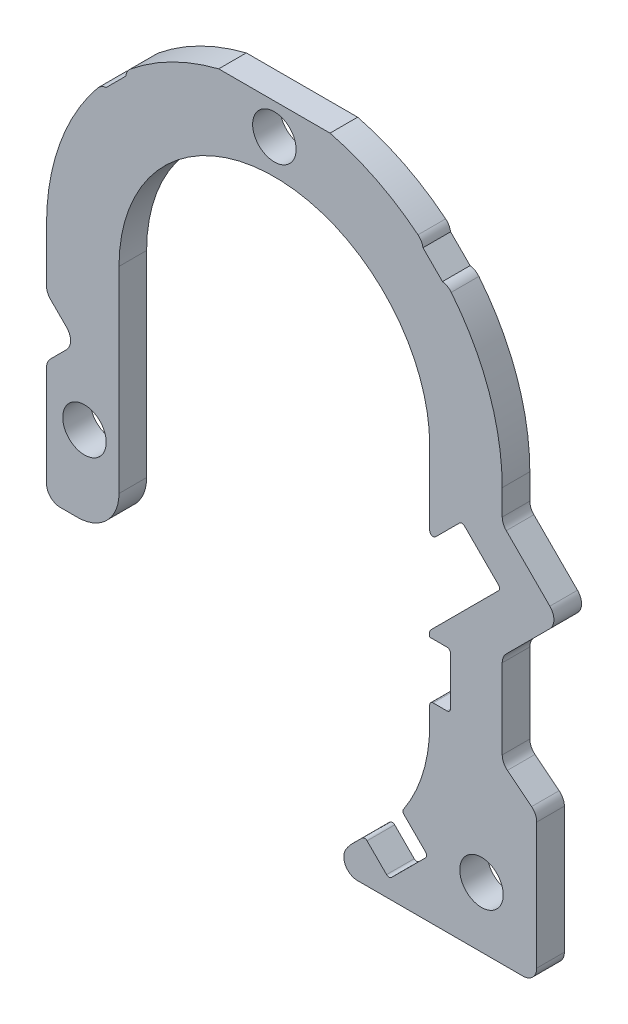
from build123d import *

# Parameters (mm, degrees)
CORPS_DEPTH                     = 4
DIAM_TRE_DU_PER_AGE_6_2_6_3_1_D = 6.3
RENFORT_CAVITE_IR_DEPTH         = 4
CAVITE_IR_DEPTH                 = 73.7636828920554
CAVITE_SWITCH_DEPTH             = 73.7636828920554
CONG_1_R                        = 2
CONG_2_R                        = 0.5


with BuildPart() as part:
    # Esquisse1 → corps (new body)
    with BuildSketch(Plane.XY):
        with BuildLine():
            Line((-21.522272155725624, 24.35069928047194), (-21.522272155725624, 25.01583101267831))
            ThreePointArc((-21.522272155725624, 25.01583101267831), (-15.198873528041206, 29.291538769388826), (-8.062257748298553, 32))
            Line((-8.062257748298553, 32), (8.062257748298553, 32))
            ThreePointArc((8.062257748298553, 32), (15.198873528041206, 29.29153876938882), (21.522272155725624, 25.015831012678305))
            Line((21.522272155725624, 25.015831012678305), (21.522272155725624, 24.350699280471943))
            Line((21.522272155725624, 24.350699280471943), (24.35069928047182, 21.522272155725762))
            Line((24.35069928047182, 21.522272155725762), (25.015831012678188, 21.522272155725762))
            ThreePointArc((25.015831012678188, 21.522272155725762), (30.93963819615851, 11.477751883135042), (33, 0))
            Line((33, 0), (33, -34.48090133377067))
            Line((33, -34.48090133377067), (38, -38.48090133377066))
            Line((38, -38.48090133377066), (38, -59.76396103067893))
            Line((38, -59.76396103067893), (9.515567427896173, -59.76396103067893))
            ThreePointArc((9.515567427896173, -59.76396103067893), (9.973004843675767, -57.46613597206372), (11.275567427896174, -55.51868129902402))
            Line((11.275567427896174, -55.51868129902402), (15.9, -50.9))
            ThreePointArc((15.9, -50.9), (20.78460969082653, -43.597044976101124), (22.500000000000004, -34.98020100629408))
            Line((22.500000000000004, -34.98020100629408), (22.5, 0))
            ThreePointArc((22.5, 0), (1.38e-15, 22.5), (-22.5, 0))
            Line((-22.5, 0), (-22.5, -28.480901333770667))
            ThreePointArc((-22.5, -28.480901333770667), (-24.257359312880713, -32.723542020889944), (-28.499999999999993, -34.48090133377067))
            Line((-28.499999999999993, -34.48090133377067), (-33, -34.48090133377067))
            Line((-33, -34.48090133377067), (-33, 0))
            ThreePointArc((-33, 0), (-30.939638196158512, 11.477751883135037), (-25.015831012678195, 21.522272155725755))
            Line((-25.015831012678195, 21.522272155725755), (-24.35069928047182, 21.52227215572576))
            Line((-24.35069928047182, 21.52227215572576), (-21.522272155725624, 24.35069928047194))
        make_face()
    extrude(amount=CORPS_DEPTH)

    # Diamètre du perçage Ø6.2 (6.3)1 (through all)
    with Locations(Plane.XY.offset(4)):
        with Locations((0, 27.5), (30, -51), (-27.5, -23)):
            Hole(DIAM_TRE_DU_PER_AGE_6_2_6_3_1_D / 2)

    # Esquisse4 → renfort_cavite_IR (add, through all)
    with BuildSketch(Plane.XY):
        Polygon((31.414213562373053, -2.928932188134515), (41.313708498984774, -12.828427124746126), (34.525483399593966, -19.61665222413702), (27.454415587728445, -26.68772003600261), (24.62598846298224, -9.717157287525408), align=None)
    extrude(amount=RENFORT_CAVITE_IR_DEPTH)

    # Esquisse4<4> → cavite_IR (cut, through all)
    with BuildSketch(Plane.XY):
        Polygon((4.3e-16, -34.34314575050794), (24.62598846298224, -9.717157287525408), (27.17157287525379, -7.171572875253825), (32.828427124746206, -12.828427124746176), (30.282842712474658, -15.37401153701776), (1.73e-15, -45.65685424949275), align=None)
        Polygon((-75.93969696196702, -31.797561338236385), (-42.82842712474626, 1.313708498984752), (-28.686291501015212, -12.828427124746126), (-61.79756133823598, -45.93969696196728), align=None)
    extrude(amount=CAVITE_IR_DEPTH, mode=Mode.SUBTRACT)

    # Esquisse5 → cavite_switch (cut, through all)
    with BuildSketch(Plane.XY):
        Polygon((18.90520382004283, -48.24834957055045), (21.910407640085666, -51.25355339059327), (22.263961030678935, -51.607106781186545), (16.607106781186562, -57.26396103067893), (16.253553390593282, -56.910407640085644), (13.24834957055045, -53.905203820042814), (12.894796179957178, -53.551650429449545), (11.671501448504449, -52.32835569799682), (17.32835569799682, -46.671501448504436), (18.55165042944955, -47.89479617995717), align=None)
        Polygon((20.249999999999996, -31.999999999999993), (18.51999999999999, -32), (18.51999999999999, -23.999999999999993), (20.249999999999996, -23.999999999999996), (20.750000000000007, -23.99999999999999), (25.000000000000007, -23.99999999999999), (25.50000000000001, -24), (25.500000000000007, -32), (25.00000000000001, -32), (20.750000000000007, -32), align=None)
    extrude(amount=CAVITE_SWITCH_DEPTH, mode=Mode.SUBTRACT)

    # Congé1
    # the kernel refuses this fillet: 2 mm, written as the material it adds along each edge
    with BuildSketch(Plane(origin=(33, -4.514718625761442, 0), x_dir=(0.7071067811865507, -0.7071067811865442, 0), z_dir=(0, 0, 1))) as cong_1_piece_1:
        with BuildLine():
            CenterArc((CONG_1_R * 0.414213562373, CONG_1_R), CONG_1_R, 224.99999999999966, 45.000000000000455)
            Line((-CONG_1_R * 0.292893218813, CONG_1_R * 0.292893218813), (0, 0))
            Line((0, 0), (CONG_1_R * 0.414213562373, 1e-17))
        make_face()
    extrude(amount=4)
    with BuildSketch(Plane(origin=(33, -21.142135623731004, 4), x_dir=(0, -1, 0), z_dir=(0, 0, -1))) as cong_1_piece_2:
        with BuildLine():
            CenterArc((CONG_1_R * 0.414213562373, -CONG_1_R), CONG_1_R, 90, 44.999999999999574)
            Line((-CONG_1_R * 0.292893218813, -CONG_1_R * 0.292893218813), (0, 0))
            Line((0, 0), (CONG_1_R * 0.414213562373, 0))
        make_face()
    extrude(amount=4)
    with BuildSketch(Plane(origin=(33, -34.48090133377067, 0), x_dir=(0.7808688094430318, -0.6246950475544225, 0), z_dir=(0, 0, 1))) as cong_1_piece_3:
        with BuildLine():
            CenterArc((CONG_1_R * 0.480624847487, CONG_1_R), CONG_1_R, 218.65980825408994, 51.34019174590992)
            Line((-CONG_1_R * 0.300243961956, CONG_1_R * 0.375304952446), (0, 0))
            Line((0, 0), (CONG_1_R * 0.480624847487, 1e-17))
        make_face()
    extrude(amount=4)
    with BuildSketch(Plane(origin=(-28.686291501015212, -12.828427124746126, 0), x_dir=(-0.7071067811865511, 0.707106781186544, 0), z_dir=(0, 0, 1))) as cong_1_piece_4:
        with BuildLine():
            CenterArc((CONG_1_R, CONG_1_R), CONG_1_R, 179.9999999999999, 90.00000000000023)
            Line((-7.52e-15, CONG_1_R), (0, 0))
            Line((0, 0), (CONG_1_R, 2e-17))
        make_face()
    extrude(amount=4)
    # the kernel refuses this fillet: 2 mm, written as the material it takes off along each edge
    with BuildSketch(Plane(origin=(-25.0158310126782, 21.52227215572575, -2.3412126230346395), x_dir=(1, 0, 0), z_dir=(0, 0, 1))) as cong_1_2_piece_1:
        with BuildLine():
            CenterArc((0.9518811347481559, -1.979336954674956), CONG_1_R, 98.24317304928408, 42.67591267968572)
            ThreePointArc((-0.6006317606021696, -0.7185024255749006), (-0.30286474640058003, -0.35712048938501084), (0, 0))
            Line((0, 0), (0.6651317322063797, 0))
        make_face()
    extrude(amount=8.682425246069279, mode=Mode.SUBTRACT)
    with BuildSketch(Plane(origin=(-21.522272155725624, 25.015831012678312, -2.341212623034707), x_dir=(0.7672332048205719, 0.6413682323133525, 0), z_dir=(0, 0, 1))) as cong_1_2_piece_2:
        with BuildLine():
            CenterArc((0.9081067143892164, -1.9997986573934323), CONG_1_R, 89.18699331013795, 42.675912679686405)
            Line((-0.4265943633407193, -0.5103111505285536), (0, 0))
            ThreePointArc((0, 0), (0.46824252460693927, 0.00332215300834937), (0.936485049213883, -9e-17))
        make_face()
    extrude(amount=8.682425246069414, mode=Mode.SUBTRACT)
    with BuildSketch(Plane(origin=(25.015831012678184, 21.522272155725762, -2.341212623034682), x_dir=(0.6413682323133517, -0.7672332048205726, 0), z_dir=(0, 0, 1))) as cong_1_2_piece_3:
        with BuildLine():
            CenterArc((0.9081067143892213, -1.9997986573934339), CONG_1_R, 89.18699331013839, 42.67591267968582)
            Line((-0.42659436334071155, -0.5103111505285509), (0, 0))
            ThreePointArc((0, 0), (0.46824252460693927, 0.00332215300834983), (0.936485049213873, -2e-17))
        make_face()
    extrude(amount=8.682425246069364, mode=Mode.SUBTRACT)
    with BuildSketch(Plane(origin=(21.522272155725624, 25.015831012678305, -2.3412126230346706), x_dir=(5.34e-15, -1, 0), z_dir=(0, 0, 1))) as cong_1_2_piece_4:
        with BuildLine():
            CenterArc((0.9518811347481454, -1.9793369546749575), CONG_1_R, 98.24317304928427, 42.67591267968571)
            ThreePointArc((-0.6006317606021806, -0.7185024255749081), (-0.30286474640058547, -0.3571204893850199), (0, 0))
            Line((0, 0), (0.6651317322063619, 0))
        make_face()
    extrude(amount=8.682425246069341, mode=Mode.SUBTRACT)
    with BuildSketch(Plane(origin=(41.313708498984774, -12.828427124746126, -4.999999999999984), x_dir=(-0.7071067811865427, -0.7071067811865525, 0), z_dir=(0, 0, 1))) as cong_1_2_piece_5:
        with BuildLine():
            CenterArc((CONG_1_R, -CONG_1_R), CONG_1_R, 90.00000000000004, 89.99999999999976)
            Line((-1.126e-14, -CONG_1_R), (0, 0))
            Line((0, 0), (CONG_1_R, -5e-17))
        make_face()
    extrude(amount=13.999999999999968, mode=Mode.SUBTRACT)
    with BuildSketch(Plane(origin=(38, -38.48090133377066, -2.403124237432852), x_dir=(0, -1, 0), z_dir=(0, 0, 1))) as cong_1_2_piece_6:
        with BuildLine():
            CenterArc((CONG_1_R * 0.480624847487, -CONG_1_R), CONG_1_R, 90, 51.340191745909806)
            Line((-CONG_1_R * 0.300243961956, -CONG_1_R * 0.375304952446), (0, 0))
            Line((0, 0), (CONG_1_R * 0.480624847487, 0))
        make_face()
    extrude(amount=8.806248474865704, mode=Mode.SUBTRACT)
    with BuildSketch(Plane(origin=(38, -59.76396103067893, -5), x_dir=(-1, 0, 0), z_dir=(0, 0, 1)), Plane(origin=(-33, -34.48090133377067, -5), x_dir=(0, 1, 0), z_dir=(0, 0, 1))) as cong_1_2_piece_7:
        with BuildLine():
            CenterArc((CONG_1_R, -CONG_1_R), CONG_1_R, 90, 90)
            Line((0, -CONG_1_R), (0, 0))
            Line((0, 0), (CONG_1_R, 0))
        make_face()
    extrude(amount=14, mode=Mode.SUBTRACT)
    with BuildSketch(Plane(origin=(9.515567427896173, -59.76396103067893, -7.764571353075624), x_dir=(1, 0, 0), z_dir=(0, 0, 1))) as cong_1_2_piece_8:
        with BuildLine():
            CenterArc((2.5358983848622465, 2), CONG_1_R, 150, 120)
            ThreePointArc((0.8038475772933698, 3), (0.20444504226559168, 1.5529142706151262), (0, 0))
            Line((0, 0), (2.5358983848622465, 0))
        make_face()
    extrude(amount=19.529142706151248, mode=Mode.SUBTRACT)
    with BuildSketch(Plane(origin=(-33, -17.142135623730965, -2.0710678118654613), x_dir=(0.7071067811865432, 0.7071067811865518, 0), z_dir=(0, 0, 1))) as cong_1_2_piece_9:
        with BuildLine():
            CenterArc((CONG_1_R * 0.414213562373, -CONG_1_R), CONG_1_R, 90.00000000000003, 44.99999999999963)
            Line((-CONG_1_R * 0.292893218813, -CONG_1_R * 0.292893218813), (0, 0))
            Line((0, 0), (CONG_1_R * 0.414213562373, 1e-17))
        make_face()
    extrude(amount=8.142135623730923, mode=Mode.SUBTRACT)
    with BuildSketch(Plane(origin=(-33, -8.51471862576139, 6.071067811865498), x_dir=(0, 1, 0), z_dir=(0, 0, -1))) as cong_1_2_piece_10:
        with BuildLine():
            CenterArc((CONG_1_R * 0.414213562373, CONG_1_R), CONG_1_R, 224.99999999999957, 45.000000000000455)
            Line((-CONG_1_R * 0.292893218813, CONG_1_R * 0.292893218813), (0, 0))
            Line((0, 0), (CONG_1_R * 0.414213562373, 0))
        make_face()
    extrude(amount=8.142135623730995, mode=Mode.SUBTRACT)

    # Congé2
    cong_2_edges = [part.edges().sort_by_distance(p)[0] for p in [
        (22.500000000000007, -11.843145750507656, 2),
        (27.17157287525379, -7.171572875253825, 2),
        (22.500000000000004, -23.15685424949253, 2),
        (32.828427124746206, -12.828427124746176, 2),
        (13.069812964361518, -53.726667213853844, 2),
        (18.47678110683533, -47.81992685734296, 2),
        (22.263961030678935, -51.607106781186545, 2),
        (16.607106781186562, -57.26396103067893, 2),
        (25.50000000000001, -24, 2),
        (22.500000000000004, -31.999999999999986, 2),
        (25.500000000000007, -32, 2),
    ]]
    fillet(cong_2_edges, radius=CONG_2_R)


solid = part.part
